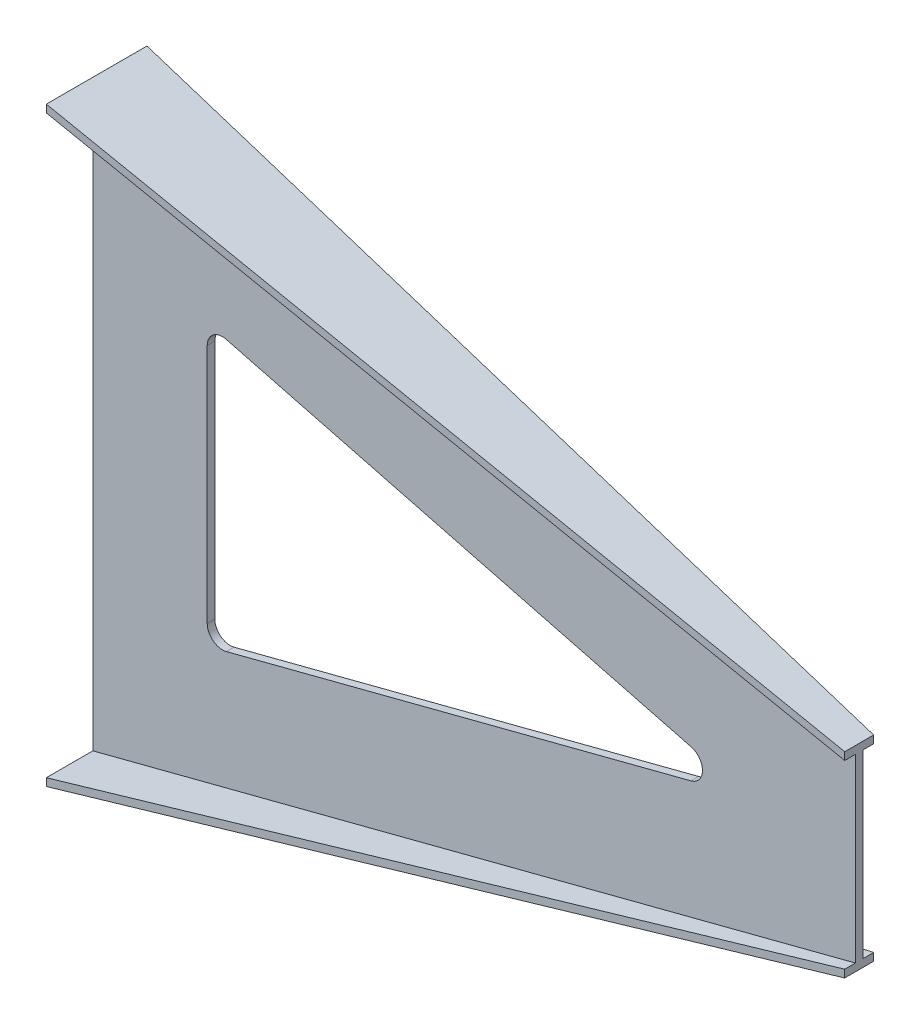
from build123d import *

# Parameters (mm, degrees)
CUT_EXTRUDE1_DEPTH = 1075.801028233


with BuildPart() as part:
    # Sketch1 → Loft l4 section 0
    with BuildSketch(Plane(origin=(0, 0, 0), x_dir=(0, 0, -1), z_dir=(1, 0, 0))):
        with BuildLine():
            Line((-71, 387.5), (61, 387.5))
            Line((61, 387.5), (61, 377.5))
            Line((61, 377.5), (0, 377.5))
            Line((0, 377.5), (0, -377.5))
            Line((0, -377.5), (61, -377.5))
            Line((61, -377.5), (61, -387.5))
            Line((61, -387.5), (-71, -387.5))
            Line((-71, -387.5), (-71, -377.5))
            Line((-71, -377.5), (-10, -377.5))
            Line((-10, -377.5), (-10, 377.5))
            Line((-10, 377.5), (-71, 377.5))
            Line((-71, 377.5), (-71, 387.5))
        make_face()
    # Sketch4 → Loft l4 section 1
    with BuildSketch(Plane(origin=(1000, 0, -1000), x_dir=(0, 0, 1), z_dir=(-1, 0, 0))):
        with BuildLine():
            Line((986, 128.5), (1024, 128.5))
            Line((1024, 128.5), (1024, 118.5))
            Line((1024, 118.5), (1010, 118.5))
            Line((1010, 118.5), (1010, -118.5))
            Line((1010, -118.5), (1024, -118.5))
            Line((1024, -118.5), (1024, -128.5))
            Line((1024, -128.5), (986, -128.5))
            Line((986, -128.5), (986, -118.5))
            Line((986, -118.5), (1000, -118.5))
            Line((1000, -118.5), (1000, 118.5))
            Line((1000, 118.5), (986, 118.5))
            Line((986, 118.5), (986, 128.5))
        make_face()
    loft()

    # Sketch5 → Cut-Extrude1 (cut, through all)
    with BuildSketch(Plane.XY.offset(10)):
        with BuildLine():
            Line((175.01453961, -177.221815075), (784.515150723, -19.361156796))
            ThreePointArc((784.515150723, -19.361156796), (799.500611112, 0), (784.515150723, 19.361156796))
            Line((784.515150723, 19.361156796), (175.01453961, 177.221815075))
            ThreePointArc((175.01453961, 177.221815075), (157.758488496, 173.676643739), (150, 157.860658278))
            Line((150, 157.860658278), (150, -157.860658278))
            ThreePointArc((150, -157.860658278), (157.758488496, -173.676643739), (175.01453961, -177.221815075))
        make_face()
    extrude(amount=-CUT_EXTRUDE1_DEPTH, mode=Mode.SUBTRACT)


solid = part.part
